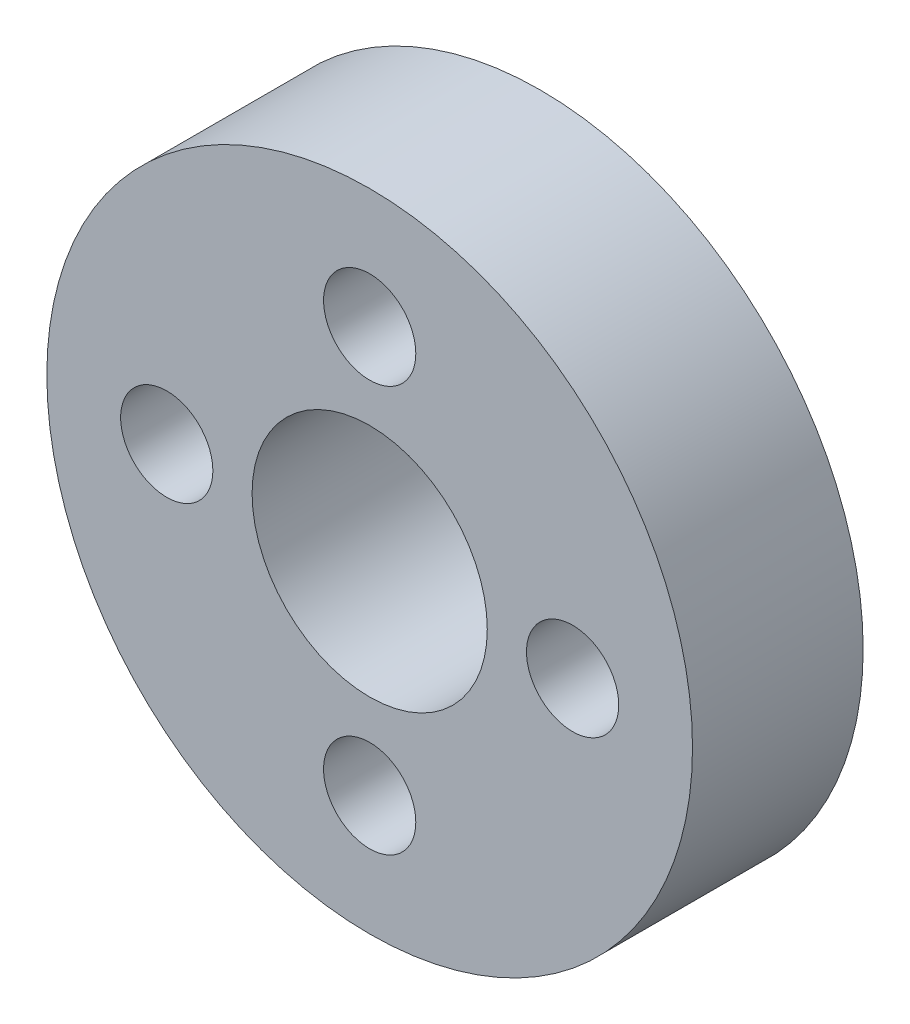
from build123d import *
from build123d.topology import SkipClean

# Parameters (mm, degrees)
SKETCH1_R           = 17.78
SKETCH1_R_2         = 2.54
SKETCH1_R_3         = 6.477
BOSS_EXTRUDE1_DEPTH = 9.398
BOSS_EXTRUDE2_START = 3.175
SKETCH2_W           = 16.51
SKETCH2_H           = 16.51
SKETCH2_R           = 6.477
BOSS_EXTRUDE2_DEPTH = 3.175


with BuildPart() as part:
    # Sketch1 → Boss-Extrude1 (new body)
    with BuildSketch(Plane.XY):
        Circle(SKETCH1_R)
        with Locations((-11.176, 0)):
            Circle(SKETCH1_R_2, mode=Mode.SUBTRACT)
        with Locations((0, -11.176)):
            Circle(SKETCH1_R_2, mode=Mode.SUBTRACT)
        with Locations((11.176, 0)):
            Circle(SKETCH1_R_2, mode=Mode.SUBTRACT)
        with Locations((0, 11.176)):
            Circle(SKETCH1_R_2, mode=Mode.SUBTRACT)
        Circle(SKETCH1_R_3, mode=Mode.SUBTRACT)
    extrude(amount=BOSS_EXTRUDE1_DEPTH)

    # Sketch2 → Boss-Extrude2 (add)
    with SkipClean():  # the faces are left unmerged after this step: merging them gives an invalid solid
        with BuildSketch(Plane(origin=(0, 0, 0), x_dir=(-1, 0, 0), z_dir=(0, 0, -1)).offset(BOSS_EXTRUDE2_START)):
            Rectangle(SKETCH2_W, SKETCH2_H)
            Circle(SKETCH2_R, mode=Mode.SUBTRACT)
        extrude(amount=-BOSS_EXTRUDE2_DEPTH)


solid = part.part
